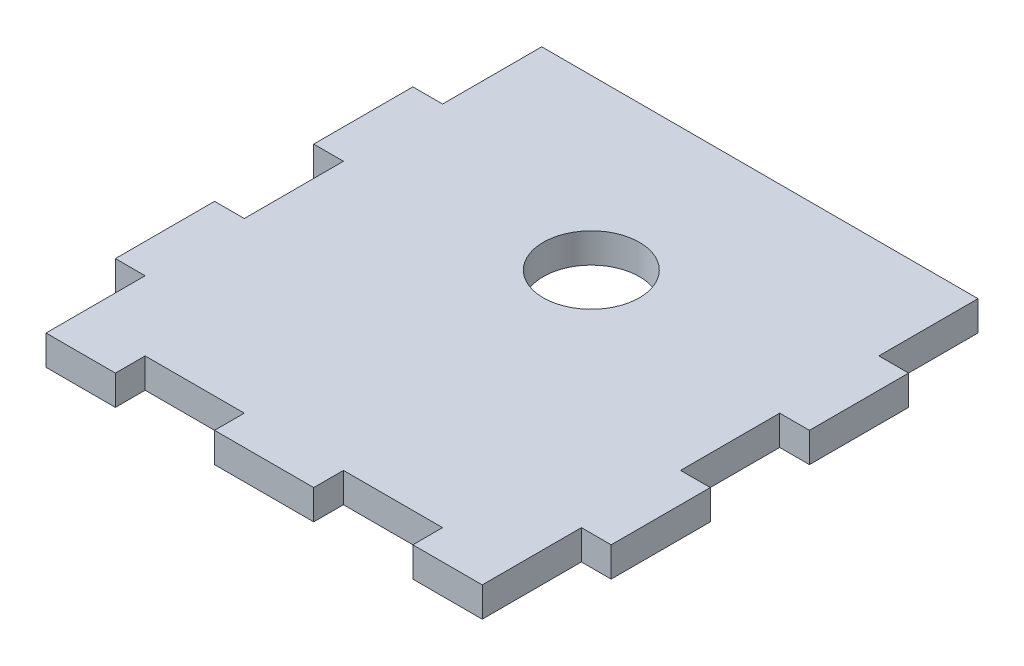
from build123d import *

# Parameters (mm, degrees)
CROQUIS1_R              = 4.85
SALIENTE_EXTRUIR1_DEPTH = 3


with BuildPart() as part:
    # Croquis1 → Saliente-Extruir1 (new body)
    with BuildSketch(Plane(origin=(0, 0, 0), x_dir=(1, 0, 0), z_dir=(0, 1, 0))):
        Polygon((3, 10), (3, 0), (10, 0), (10, 3), (20, 3), (20, 0), (25, 0), (30, 0), (30, 3), (40, 3), (40, 0), (47, 0), (47, 10), (50, 10), (50, 20), (47, 20), (47, 30), (50, 30), (50, 40), (47, 40), (47, 50), (3, 50), (3, 40), (0, 40), (0, 30), (3, 30), (3, 20), (0, 20), (0, 10), align=None)
        with Locations((25, 33)):
            Circle(CROQUIS1_R, mode=Mode.SUBTRACT)
    extrude(amount=SALIENTE_EXTRUIR1_DEPTH)


solid = part.part
